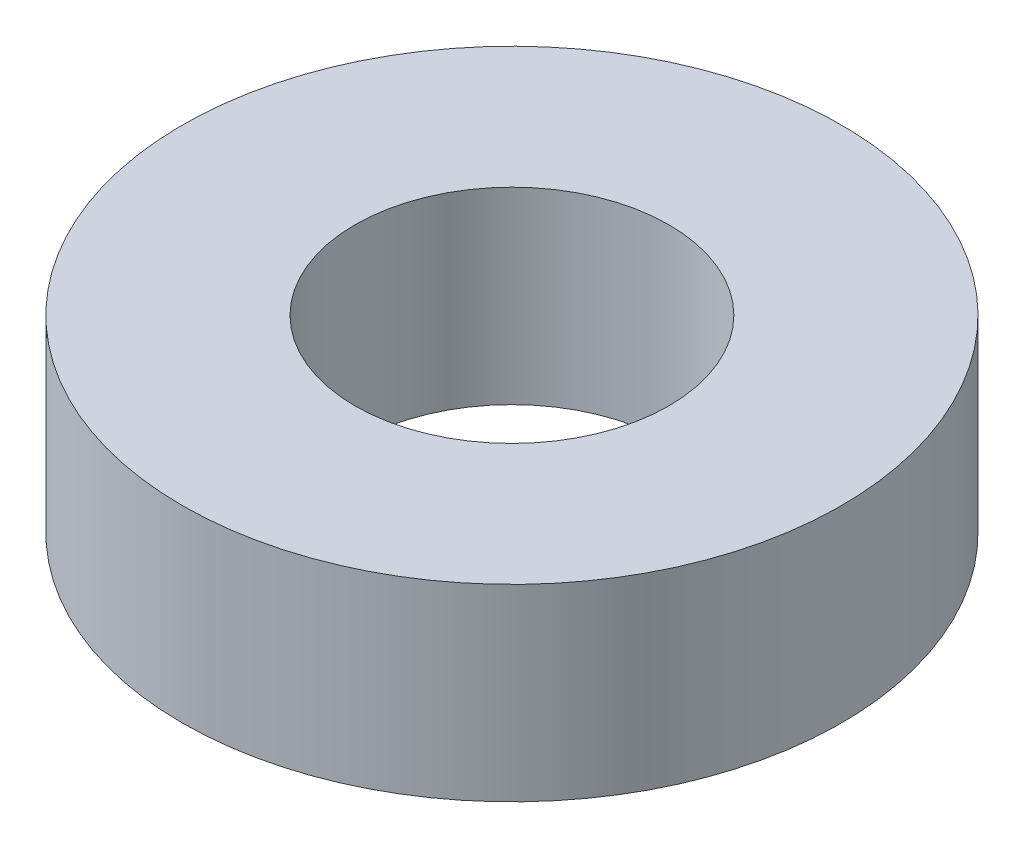
from build123d import *

# Parameters (mm, degrees)
SKETCH1_R           = 21
BOSS_EXTRUDE1_DEPTH = 12
SKETCH2_R           = 10
CUT_EXTRUDE1_DEPTH  = 12


with BuildPart() as part:
    # Sketch1 → Boss-Extrude1 (new body)
    with BuildSketch(Plane(origin=(0, 0, 0), x_dir=(1, 0, 0), z_dir=(0, 1, 0))):
        Circle(SKETCH1_R)
    extrude(amount=BOSS_EXTRUDE1_DEPTH)

    # Sketch2 → Cut-Extrude1 (cut)
    with BuildSketch(Plane(origin=(0, 12, 0), x_dir=(1, 0, 0), z_dir=(0, 1, 0))):
        Circle(SKETCH2_R)
    extrude(amount=-CUT_EXTRUDE1_DEPTH, mode=Mode.SUBTRACT)


solid = part.part
